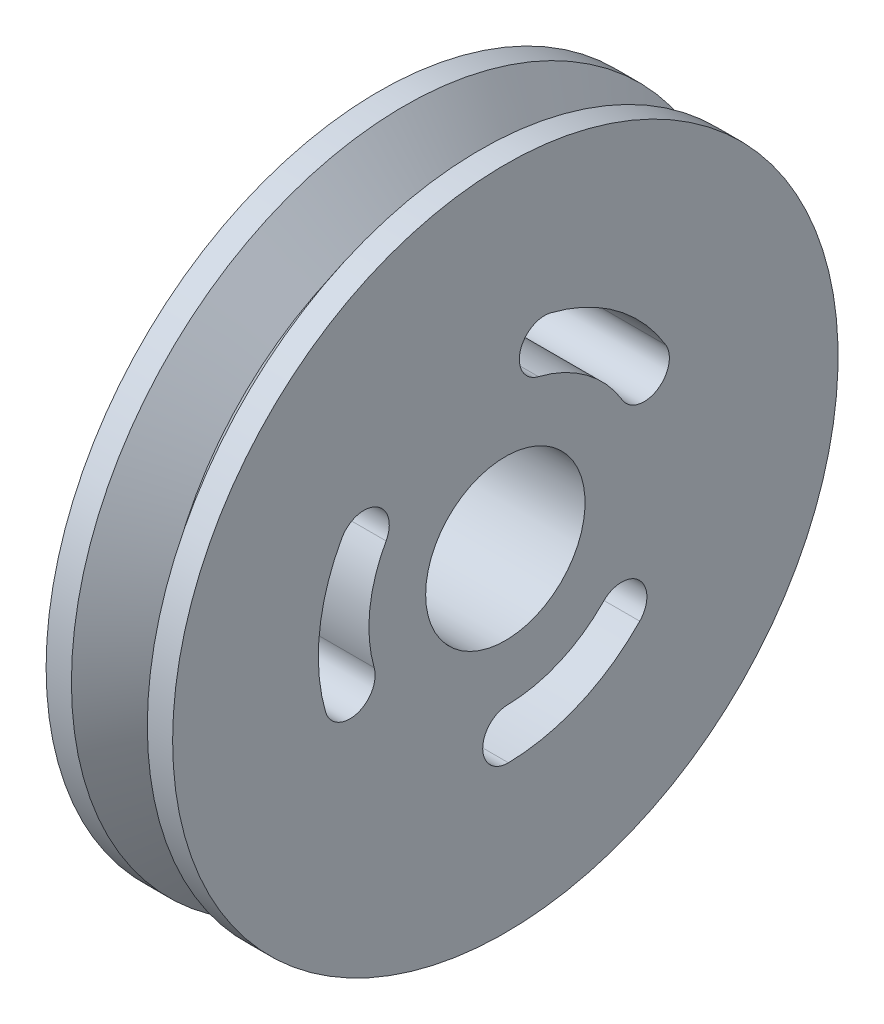
from build123d import *

# Parameters (mm, degrees)
CUT_EXTRUDE1_DEPTH      = 25.4561342
CUT_EXTRUDE1_DEPTH_BACK = 25.4561342


with BuildPart() as part:
    # Sketch1 → Revolve1 (revolve)
    with BuildSketch(Plane.XY):
        Polygon((1.27, 16.7), (3.175, 14.16), (5.08, 16.7), (6.35, 16.7), (6.35, 4), (0, 4), (0, 16.7), align=None)
    revolve(axis=Axis((0, 0, 0), (1, 0, 0)))

    # Sketch2 → Cut-Extrude1 (cut, two sides: drawn at the far end of the back side and taken through both)
    with BuildSketch(Plane.ZY.offset(-CUT_EXTRUDE1_DEPTH_BACK)):
        with BuildLine():
            ThreePointArc((-4.920971786, -4.761539006), (-6.716779577, -4.731969132), (-6.746349452, -6.527776923))
            ThreePointArc((-6.746349452, -6.527776923), (-3.734742099, -8.612595656), (-0.154554118, -9.386224774))
            ThreePointArc((-0.154554118, -9.386224774), (1.136182808, -8.137305966), (-0.112736, -6.84656904))
            ThreePointArc((-0.112736, -6.84656904), (-2.724223023, -6.282262805), (-4.920971786, -4.761539006))
        make_face()
        with BuildLine():
            ThreePointArc((-1.663127847, 6.642456081), (-0.739615689, 8.182886311), (-2.280045919, 9.106398469))
            ThreePointArc((-2.280045919, 9.106398469), (-5.591355581, 7.540679363), (-8.051432041, 4.826960179))
            ThreePointArc((-8.051432041, 4.826960179), (-7.615205089, 3.084689808), (-5.872934718, 3.52091676))
            ThreePointArc((-5.872934718, 3.52091676), (-4.07848767, 5.500377746), (-1.663127847, 6.642456081))
        make_face()
        with BuildLine():
            ThreePointArc((6.584099633, -1.880917075), (7.456395267, -3.45091718), (9.026395371, -2.578621547))
            ThreePointArc((9.026395371, -2.578621547), (9.32609768, 1.071916293), (8.205986159, 4.559264595))
            ThreePointArc((8.205986159, 4.559264595), (6.479022281, 5.052616158), (5.985670718, 3.32565228))
            ThreePointArc((5.985670718, 3.32565228), (6.802710694, 0.781885059), (6.584099633, -1.880917075))
        make_face()
    extrude(amount=CUT_EXTRUDE1_DEPTH + CUT_EXTRUDE1_DEPTH_BACK, mode=Mode.SUBTRACT)


solid = part.part
